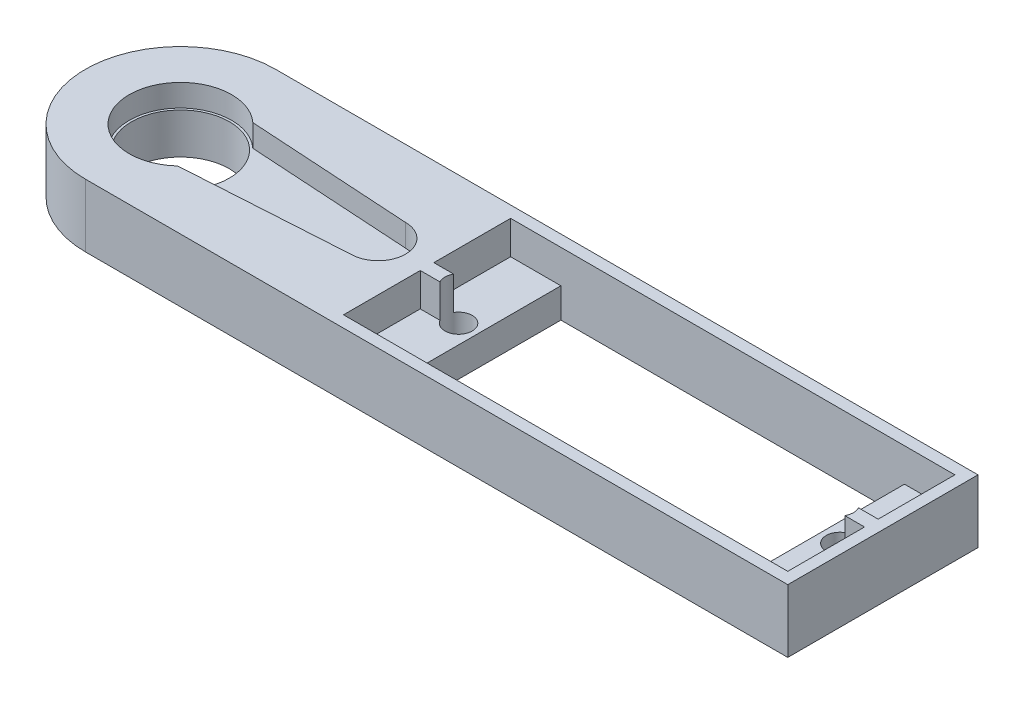
from build123d import *

# Parameters (mm, degrees)
BOSS_EXTRUDE1_DEPTH       = 3
SKETCH2_R                 = 3.6
CUT_EXTRUDE1_DEPTH        = 3.95
BOSS_EXTRUDE2_DEPTH       = 1.64
SKETCH4_R                 = 3.25
CUT_EXTRUDE2_DEPTH        = 63.566201739
CAVITY1_OUTLINE_R         = 3.25
CAVITY1_DEPTH             = 4.64
CAVITY1_START             = 3.19
CAVITY1_2_DEPTH           = 1.45
CUT_EXTRUDE4_DEPTH        = 63.566201739
BOSS_EXTRUDE3_START       = -4.64
BOSS_EXTRUDE3_DEPTH       = 4.64
BOSS_EXTRUDE4_DEPTH       = 4.64
BOSS_EXTRUDE5_DEPTH       = 4.64
CUT_EXTRUDE5_DEPTH        = 1.45
SKETCH7_R                 = 1
CUT_EXTRUDE6_DEPTH        = 4.64
CUT_EXTRUDE7_DEPTH        = 68.226628653
CUT_EXTRUDE7_DEPTH_BACK   = 68.226628653
SKETCH10_W                = 23.28963149
SKETCH10_H                = 12.3
SKETCH10_W_2              = 22.98963149
SKETCH10_H_2              = 12
CUT_EXTRUDE8_DEPTH        = 1.45
CUT_EXTRUDE9_DEPTH        = 1.45
SKETCH14_W                = 12.3
SKETCH14_H                = 3.19
CUT_EXTRUDE10_DEPTH       = 1
SKETCH15_W                = 12.3
SKETCH15_H                = 3.19
CUT_EXTRUDE11_DEPTH       = 1
CUT_EXTRUDE12_DEPTH       = 1
CUT_EXTRUDE13_DEPTH       = 1
CUT_EXTRUDE14_REACH       = 69.227
SKETCH18_W                = 15
SKETCH18_H                = 14
BODY_MOVE_COPY1_OUTLINE_R = 3.6
BODY_MOVE_COPY1_DEPTH     = 4.64
BODY_MOVE_COPY1_START     = 3
BODY_MOVE_COPY1_2_DEPTH   = 1.64
BODY_MOVE_COPY1_3_DEPTH   = 4.64
BODY_MOVE_COPY1_4_DEPTH   = 3


# Read off the part's stored shape, not the designer's step: Cavity1, Body-Move/Copy1
with BuildPart() as part:
    # Sketch1 → Boss-Extrude1 (new body)
    with BuildSketch(Plane(origin=(0, 0, 0), x_dir=(1, 0, 0), z_dir=(0, 1, 0))):
        with BuildLine():
            Line((0, 7), (55, 7))
            ThreePointArc((55, 7), (62, 0), (55, -7))
            Line((55, -7), (0, -7))
            ThreePointArc((0, -7), (-7, 0), (0, 7))
        make_face()
    extrude(amount=BOSS_EXTRUDE1_DEPTH)

    # Sketch2 → Cut-Extrude1 (cut)
    with BuildSketch(Plane.XZ):
        with Locations(Location((0, 0, 0), (0, 0, 270))):
            Circle(SKETCH2_R)
    extrude(amount=-CUT_EXTRUDE1_DEPTH, mode=Mode.SUBTRACT)

    # Sketch3 → Boss-Extrude2 (add)
    with BuildSketch(Plane(origin=(0, 3, 0), x_dir=(1, 0, 0), z_dir=(0, 1, 0))):
        with BuildLine():
            Line((0, -7), (55, -7))
            ThreePointArc((55, -7), (62, 0), (55, 7))
            Line((55, 7), (0, 7))
            ThreePointArc((0, 7), (-7, 0), (0, -7))
        make_face()
        with BuildLine():
            Line((14.555396889, 2.01999279), (2.561818442, 2.765860855))
            ThreePointArc((2.561818442, 2.765860855), (-3.77, 0), (2.561818442, -2.765860855))
            Line((2.561818442, -2.765860855), (14.555396889, -2.01999279))
            ThreePointArc((14.555396889, -2.01999279), (16.57, 0), (14.555396889, 2.01999279))
        make_face(mode=Mode.SUBTRACT)
    extrude(amount=BOSS_EXTRUDE2_DEPTH)

    # Sketch4 → Cut-Extrude2 (cut, through all)
    with BuildSketch(Plane(origin=(0, 4.64, 0), x_dir=(1, 0, 0), z_dir=(0, 1, 0))):
        with Locations(Location((55, 0, 0), (0, 0, 270))):
            Circle(SKETCH4_R)
    extrude(amount=-CUT_EXTRUDE2_DEPTH, mode=Mode.SUBTRACT)

    # Cavity1 outline → Cavity1 (cut)
    with BuildSketch(Plane(origin=(0, 0, 0), x_dir=(1, 0, 0), z_dir=(0, 1, 0))):
        with BuildLine():
            Line((58.605551275, 6), (38, 6))
            Line((38, 6), (38, -6))
            Line((38, -6), (58.605551275, -6))
            ThreePointArc((58.605551275, -6), (59.949747468, -4.949747468), (61, -3.605551275))
            Line((61, -3.605551275), (61, 3.605551275))
            ThreePointArc((61, 3.605551275), (59.949747468, 4.949747468), (58.605551275, 6))
        make_face()
        with Locations((55, 0)):
            Circle(CAVITY1_OUTLINE_R, mode=Mode.SUBTRACT)
    extrude(amount=CAVITY1_DEPTH, mode=Mode.SUBTRACT)

    # Cavity1 2 outline → Cavity1 2 (cut)
    with BuildSketch(Plane(origin=(0, 0, 0), x_dir=(1, 0, 0), z_dir=(0, 1, 0)).offset(CAVITY1_START)):
        with BuildLine():
            Line((33.3, 0.5), (34.605619966, 0.5))
            ThreePointArc((34.605619966, 0.5), (36.47164537, 0), (34.605619966, -0.5))
            Line((34.605619966, -0.5), (33.3, -0.5))
            Line((33.3, -0.5), (33.3, -6))
            Line((33.3, -6), (38, -6))
            Line((38, -6), (38, 6))
            Line((38, 6), (33.3, 6))
            Line((33.3, 6), (33.3, 0.5))
        make_face()
        with BuildLine():
            ThreePointArc((61, -3.605551275), (62, 0), (61, 3.605551275))
            Line((61, 3.605551275), (61, -3.605551275))
        make_face()
    extrude(amount=CAVITY1_2_DEPTH, mode=Mode.SUBTRACT)

    # Sketch5 → Cut-Extrude4 (cut, through all)
    with BuildSketch(Plane.XZ):
        with BuildLine():
            Line((61, 3.605551275), (61, -3.605551275))
            ThreePointArc((61, -3.605551275), (62, 0), (61, 3.605551275))
        make_face()
    extrude(amount=-CUT_EXTRUDE4_DEPTH, mode=Mode.SUBTRACT)

    # Sketch6 → Boss-Extrude3 (add)
    with BuildSketch(Plane(origin=(0, 4.64, 0), x_dir=(1, 0, 0), z_dir=(0, 1, 0)).offset(BOSS_EXTRUDE3_START)):
        with BuildLine():
            Line((61, -6), (58.605551275, -6))
            ThreePointArc((58.605551275, -6), (56.870828693, -6.745368782), (55, -7))
            Line((55, -7), (66.7, -7))
            Line((66.7, -7), (66.7, 7))
            Line((66.7, 7), (55, 7))
            ThreePointArc((55, 7), (56.870828693, 6.745368782), (58.605551275, 6))
            Line((58.605551275, 6), (61, 6))
            Line((61, 6), (65.7, 6))
            Line((65.7, 6), (65.7, 0.5))
            Line((65.7, 0.5), (65.7, -0.5))
            Line((65.7, -0.5), (65.7, -6))
            Line((65.7, -6), (61, -6))
        make_face()
        with BuildLine():
            Line((58.605551275, -6), (33.3, -6))
            Line((33.3, -6), (33.3, -7))
            Line((33.3, -7), (55, -7))
            ThreePointArc((55, -7), (56.870828693, -6.745368782), (58.605551275, -6))
        make_face()
        with BuildLine():
            Line((33.3, 7), (33.3, 6))
            Line((33.3, 6), (58.605551275, 6))
            ThreePointArc((58.605551275, 6), (56.870828693, 6.745368782), (55, 7))
            Line((55, 7), (33.3, 7))
        make_face()
    extrude(amount=BOSS_EXTRUDE3_DEPTH)

    # Sketch6<3> → Boss-Extrude4 (add)
    with BuildSketch(Plane(origin=(0, 4.64, 0), x_dir=(1, 0, 0), z_dir=(0, 1, 0))):
        with BuildLine():
            Line((64.394380034, -0.5), (65.7, -0.5))
            Line((65.7, -0.5), (65.7, 0.5))
            Line((65.7, 0.5), (64.394380034, 0.5))
            ThreePointArc((64.394380034, 0.5), (62.52835463, 0), (64.394380034, -0.5))
        make_face()
    extrude(amount=-BOSS_EXTRUDE4_DEPTH)

    # Sketch6<5> → Boss-Extrude5 (add)
    with BuildSketch(Plane(origin=(0, 4.64, 0), x_dir=(1, 0, 0), z_dir=(0, 1, 0))):
        with BuildLine():
            Line((61, 6), (61, -6))
            Line((61, -6), (65.7, -6))
            Line((65.7, -6), (65.7, -0.5))
            Line((65.7, -0.5), (64.394380034, -0.5))
            ThreePointArc((64.394380034, -0.5), (62.52835463, 0), (64.394380034, 0.5))
            Line((64.394380034, 0.5), (65.7, 0.5))
            Line((65.7, 0.5), (65.7, 6))
            Line((65.7, 6), (61, 6))
        make_face()
    extrude(amount=-BOSS_EXTRUDE5_DEPTH)

    # Sketch6<6> → Cut-Extrude5 (cut)
    with BuildSketch(Plane(origin=(0, 4.64, 0), x_dir=(1, 0, 0), z_dir=(0, 1, 0))):
        with BuildLine():
            Line((61, 6), (61, -6))
            Line((61, -6), (65.7, -6))
            Line((65.7, -6), (65.7, -0.5))
            Line((65.7, -0.5), (64.394380034, -0.5))
            ThreePointArc((64.394380034, -0.5), (62.52835463, 0), (64.394380034, 0.5))
            Line((64.394380034, 0.5), (65.7, 0.5))
            Line((65.7, 0.5), (65.7, 6))
            Line((65.7, 6), (61, 6))
        make_face()
    extrude(amount=-CUT_EXTRUDE5_DEPTH, mode=Mode.SUBTRACT)

    # Sketch7 → Cut-Extrude6 (cut)
    with BuildSketch(Plane(origin=(0, 4.64, 0), x_dir=(1, 0, 0), z_dir=(0, 1, 0))):
        with Locations(Location((63.52835463, 0, 0), (0, 0, 270))):
            Circle(SKETCH7_R)
        with Locations(Location((35.47164537, 0, 0), (0, 0, 270))):
            Circle(SKETCH7_R)
    extrude(amount=-CUT_EXTRUDE6_DEPTH, mode=Mode.SUBTRACT)

    # Sketch10 → Cut-Extrude7 (cut, two sides: drawn at the far end of the back side and taken through both)
    with BuildSketch(Plane.XZ.offset(-CUT_EXTRUDE7_DEPTH_BACK)):
        with Locations((49.494815745, 0)):
            Rectangle(SKETCH10_W, SKETCH10_H)
        with Locations((49.494815745, 0)):
            Rectangle(SKETCH10_W_2, SKETCH10_H_2, mode=Mode.SUBTRACT)
    extrude(amount=CUT_EXTRUDE7_DEPTH + CUT_EXTRUDE7_DEPTH_BACK, mode=Mode.SUBTRACT)

    # Sketch11 → Cut-Extrude8 (cut)
    with BuildSketch(Plane(origin=(0, 4.64, 0), x_dir=(1, 0, 0), z_dir=(0, 1, 0))):
        Polygon((37.85, -6), (33.3, -6), (33.3, -0.5), (33.15, -0.5), (33.15, -6.15), (37.85, -6.15), align=None)
        Polygon((33.3, 0.5), (33.3, 6), (37.85, 6), (37.85, 6.15), (33.15, 6.15), (33.15, 0.5), align=None)
    extrude(amount=-CUT_EXTRUDE8_DEPTH, mode=Mode.SUBTRACT)

    # Sketch13 → Cut-Extrude9 (cut)
    with BuildSketch(Plane(origin=(0, 4.64, 0), x_dir=(1, 0, 0), z_dir=(0, 1, 0))):
        Polygon((61.13963149, -6), (65.7, -6), (65.7, -0.5), (65.85, -0.5), (65.85, -6.15), (61.13963149, -6.15), align=None)
        Polygon((61.13963149, 6), (65.7, 6), (65.7, 0.5), (65.85, 0.5), (65.85, 6.15), (61.13963149, 6.15), align=None)
    extrude(amount=-CUT_EXTRUDE9_DEPTH, mode=Mode.SUBTRACT)

    # Sketch14 → Cut-Extrude10 (cut)
    with BuildSketch(Plane(origin=(37.85, 0, 0), x_dir=(0, 0, -1), z_dir=(1, 0, 0))):
        with Locations((0, 1.595)):
            Rectangle(SKETCH14_W, SKETCH14_H)
    extrude(amount=-CUT_EXTRUDE10_DEPTH, mode=Mode.SUBTRACT)

    # Sketch15 → Cut-Extrude11 (cut)
    with BuildSketch(Plane.ZY.offset(-61.13963149)):
        with Locations((0, 1.595)):
            Rectangle(SKETCH15_W, SKETCH15_H)
    extrude(amount=-CUT_EXTRUDE11_DEPTH, mode=Mode.SUBTRACT)

    # Sketch16 → Cut-Extrude12 (cut)
    with BuildSketch(Plane(origin=(0, 3.19, 0), x_dir=(1, 0, 0), z_dir=(0, 1, 0))):
        with BuildLine():
            Line((62.13963149, 6.15), (62.13963149, -6.15))
            Line((62.13963149, -6.15), (65.85, -6.15))
            Line((65.85, -6.15), (65.85, -0.5))
            Line((65.85, -0.5), (64.394380034, -0.5))
            ThreePointArc((64.394380034, -0.5), (62.52835463, 0), (64.394380034, 0.5))
            Line((64.394380034, 0.5), (65.85, 0.5))
            Line((65.85, 0.5), (65.85, 6.15))
            Line((65.85, 6.15), (62.13963149, 6.15))
        make_face()
    extrude(amount=-CUT_EXTRUDE12_DEPTH, mode=Mode.SUBTRACT)

    # Sketch17 → Cut-Extrude13 (cut)
    with BuildSketch(Plane(origin=(0, 3.19, 0), x_dir=(1, 0, 0), z_dir=(0, 1, 0))):
        with BuildLine():
            Line((36.85, -6.15), (36.85, 6.15))
            Line((36.85, 6.15), (33.15, 6.15))
            Line((33.15, 6.15), (33.15, 0.5))
            Line((33.15, 0.5), (34.605619966, 0.5))
            ThreePointArc((34.605619966, 0.5), (36.47164537, 0), (34.605619966, -0.5))
            Line((34.605619966, -0.5), (33.15, -0.5))
            Line((33.15, -0.5), (33.15, -6.15))
            Line((33.15, -6.15), (36.85, -6.15))
        make_face()
    extrude(amount=-CUT_EXTRUDE13_DEPTH, mode=Mode.SUBTRACT)

    # Sketch18 → Cut-Extrude14 (cut, up to next)
    with BuildSketch(Plane(origin=(0, 4.64, 0), x_dir=(1, 0, 0), z_dir=(0, 1, 0)), mode=Mode.PRIVATE) as cut_extrude14_sk1:
        with Locations((25.65, 0)):
            Rectangle(SKETCH18_W, SKETCH18_H)
    cut_extrude14_tool1 = extrude(cut_extrude14_sk1.sketch, amount=-CUT_EXTRUDE14_REACH, mode=Mode.PRIVATE) & part.part
    add(cut_extrude14_tool1.solids().sort_by_distance((25.65, 4.64, 0))[0], mode=Mode.SUBTRACT)


with BuildPart() as cut_extrude14_piece_1:
    # of the separate pieces the step leaves, piece 1, a body of its own (cut_extrude14_pieces)
    add(part.part.solids().sort_by_distance((18.15, 0, -7))[0])

    # Body-Move/Copy1 outline → Body-Move/Copy1 (cut)
    # profile 1 of 2: a face of its own
    with BuildSketch(Plane(origin=(0, 0, 0), x_dir=(1, 0, 0), z_dir=(0, 1, 0))):
        with BuildLine():
            Line((15, 7), (0, 7))
            ThreePointArc((0, 7), (-7, 0), (0, -7))
            Line((0, -7), (15, -7))
            ThreePointArc((15, -7), (8, 0), (15, 7))
        make_face()
        Circle(BODY_MOVE_COPY1_OUTLINE_R, mode=Mode.SUBTRACT)
    # profile 2 of 2: a face of its own
    with BuildSketch(Plane(origin=(0, 0, 0), x_dir=(1, 0, 0), z_dir=(0, 1, 0))):
        with BuildLine():
            Line((18.15, -1.742842506), (18.15, 1.742842506))
            ThreePointArc((18.15, 1.742842506), (11.4, 0), (18.15, -1.742842506))
        make_face()
    extrude(amount=BODY_MOVE_COPY1_DEPTH, mode=Mode.SUBTRACT)

    # Body-Move_Copy1 2 outline → Body-Move_Copy1 2 (cut)
    with BuildSketch(Plane(origin=(0, 0, 0), x_dir=(1, 0, 0), z_dir=(0, 1, 0)).offset(BODY_MOVE_COPY1_START)):
        with BuildLine():
            Line((18.15, 1.742842506), (18.15, 2.729282461))
            Line((18.15, 2.729282461), (17.561818442, 2.765860855))
            ThreePointArc((17.561818442, 2.765860855), (14.612436332, 3.75002592), (11.926670151, 2.183470549))
            Line((11.926670151, 2.183470549), (12.128234154, 2.170935495))
            ThreePointArc((12.128234154, 2.170935495), (15.255283103, 3.590937278), (18.15, 1.742842506))
        make_face()
        with BuildLine():
            Line((12.128234154, -2.170935495), (11.926670151, -2.183470549))
            ThreePointArc((11.926670151, -2.183470549), (14.612436332, -3.75002592), (17.561818442, -2.765860855))
            Line((17.561818442, -2.765860855), (18.15, -2.729282461))
            Line((18.15, -2.729282461), (18.15, -1.742842506))
            ThreePointArc((18.15, -1.742842506), (15.255283103, -3.590937278), (12.128234154, -2.170935495))
        make_face()
    extrude(amount=BODY_MOVE_COPY1_2_DEPTH, mode=Mode.SUBTRACT)

    # Body-Move_Copy1 3 outline → Body-Move_Copy1 3 (add)
    with BuildSketch(Plane(origin=(0, 0, 0), x_dir=(1, 0, 0), z_dir=(0, 1, 0))):
        with BuildLine():
            Line((33.15, 7), (18.15, 7))
            Line((18.15, 7), (18.15, 2.729282461))
            Line((18.15, 2.729282461), (29.555396889, 2.01999279))
            ThreePointArc((29.555396889, 2.01999279), (31.57, 0), (29.555396889, -2.01999279))
            Line((29.555396889, -2.01999279), (18.15, -2.729282461))
            Line((18.15, -2.729282461), (18.15, -7))
            Line((18.15, -7), (33.15, -7))
            Line((33.15, -7), (33.15, 7))
        make_face()
        with BuildLine():
            Line((11.926670151, 2.183470549), (8.424744076, 2.401251659))
            ThreePointArc((8.424744076, 2.401251659), (8, 0), (8.424744076, -2.401251659))
            Line((8.424744076, -2.401251659), (11.926670151, -2.183470549))
            ThreePointArc((11.926670151, -2.183470549), (11.23, 0), (11.926670151, 2.183470549))
        make_face()
    extrude(amount=BODY_MOVE_COPY1_3_DEPTH)

    # Body-Move_Copy1 4 outline → Body-Move_Copy1 4 (add)
    with BuildSketch(Plane(origin=(0, 0, 0), x_dir=(1, 0, 0), z_dir=(0, 1, 0))):
        with BuildLine():
            Line((29.555396889, 2.01999279), (18.15, 2.729282461))
            Line((18.15, 2.729282461), (18.15, 1.742842506))
            ThreePointArc((18.15, 1.742842506), (18.6, 0), (18.15, -1.742842506))
            Line((18.15, -1.742842506), (18.15, -2.729282461))
            Line((18.15, -2.729282461), (29.555396889, -2.01999279))
            ThreePointArc((29.555396889, -2.01999279), (31.57, 0), (29.555396889, 2.01999279))
        make_face()
    extrude(amount=BODY_MOVE_COPY1_4_DEPTH)


with BuildPart() as cut_extrude14_piece_2:
    # of the separate pieces the step leaves, piece 2, a body of its own (cut_extrude14_pieces)
    add(part.part.solids().sort_by_distance((66.7, 0, -7))[0])


with BuildPart() as cut_extrude14_piece_1_1:
    add(cut_extrude14_piece_1.part)

    # Combine1: union Cut-Extrude14 piece 2
    add(cut_extrude14_piece_2.part)


solid = cut_extrude14_piece_1_1.part
